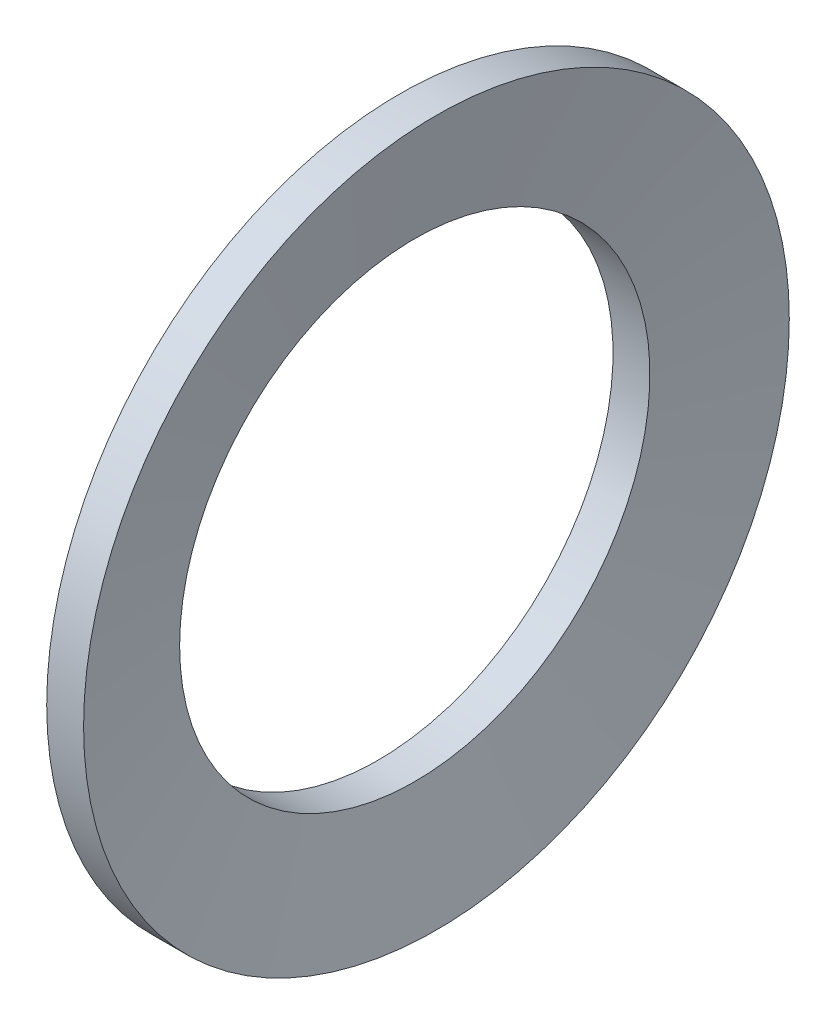
from build123d import *


with BuildPart() as part:
    # Sketch1 → Revolve1 (revolve)
    with BuildSketch(Plane.XY):
        Polygon((-2.4892, 9.9949), (-1.567706327, 14.9987), (0, 14.9987), (-0.921493673, 9.9949), align=None)
    revolve(axis=Axis((0, 0, 0), (1, 0, 0)))


solid = part.part
